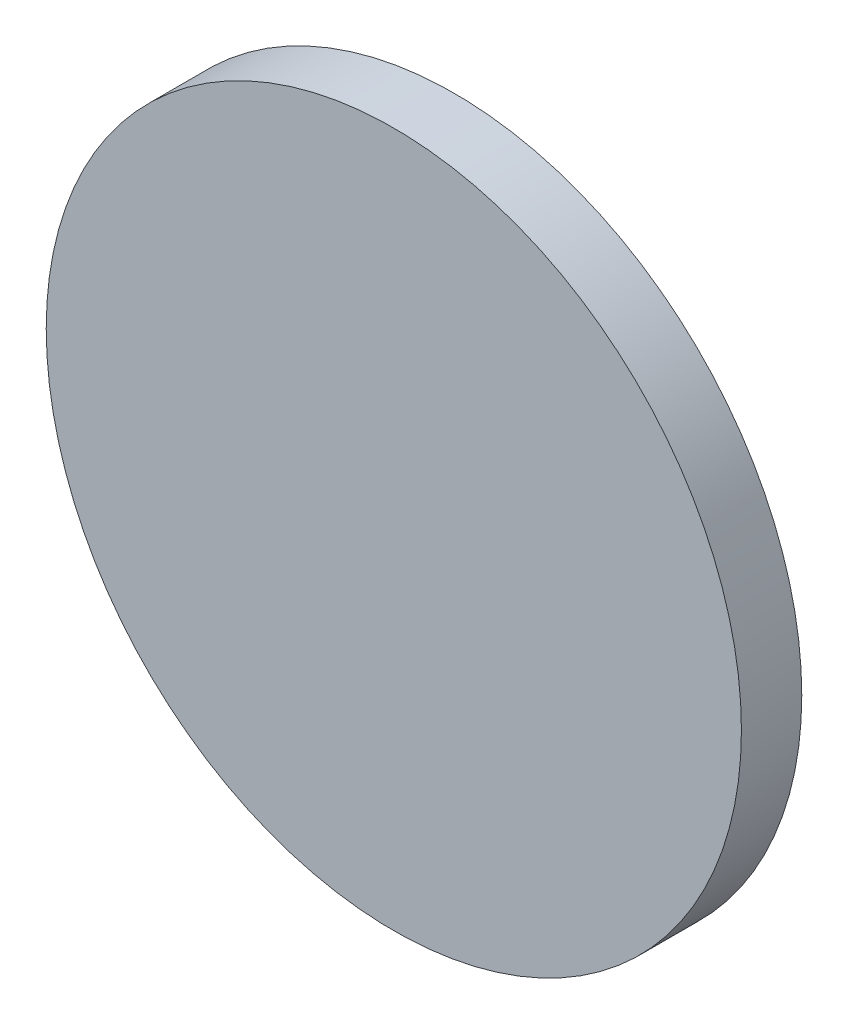
from build123d import *

# Parameters (mm, degrees)
SCHIZZO1_R                   = 28.8
ESTRUSIONE_ESTRUSIONE1_DEPTH = 5


with BuildPart() as part:
    # Schizzo1 → Estrusione-Estrusione1 (new body)
    with BuildSketch(Plane.XY):
        Circle(SCHIZZO1_R)
    extrude(amount=ESTRUSIONE_ESTRUSIONE1_DEPTH)


solid = part.part
